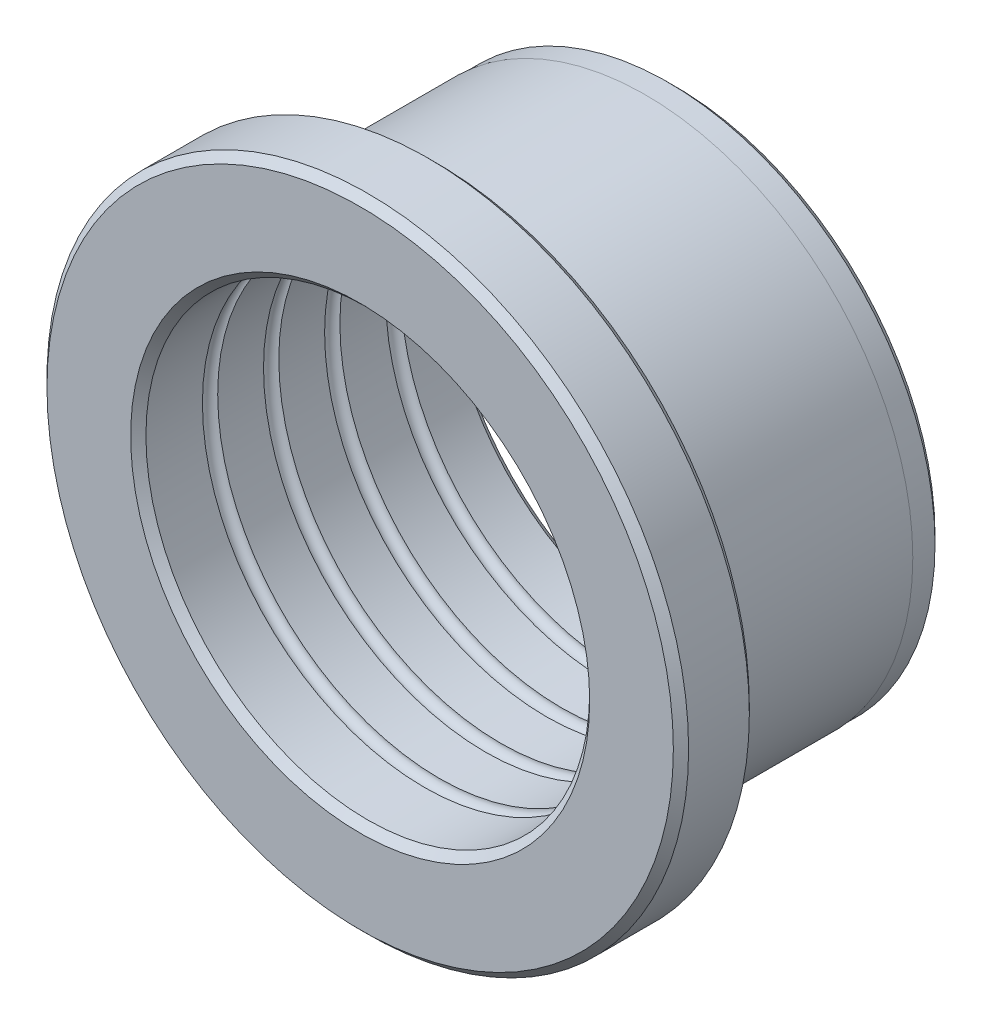
from build123d import *


with BuildPart() as part:
    # Sketch1 → Revolve1 (revolve)
    with BuildSketch(Plane(origin=(0, 0, 0), x_dir=(0, 0, -1), z_dir=(1, 0, 0))):
        with BuildLine():
            Line((0.5, 14.5275), (4.20000625, 14.5275))
            ThreePointArc((4.20000625, 14.5275), (4.7, 15.025), (5.19999375, 14.5275))
            Line((5.19999375, 14.5275), (8.20000625, 14.5275))
            ThreePointArc((8.20000625, 14.5275), (8.7, 15.025), (9.19999375, 14.5275))
            Line((9.19999375, 14.5275), (12.20000625, 14.5275))
            ThreePointArc((12.20000625, 14.5275), (12.7, 15.025), (13.19999375, 14.5275))
            Line((13.19999375, 14.5275), (16.20000625, 14.5275))
            ThreePointArc((16.20000625, 14.5275), (16.7, 15.025), (17.19999375, 14.5275))
            Line((17.19999375, 14.5275), (20.175, 14.5275))
            Line((20.175, 14.5275), (20.675, 15.0275))
            Line((20.675, 15.0275), (20.675, 16.9625))
            Line((20.675, 16.9625), (20.175, 17.4625))
            Line((20.175, 17.4625), (18.675, 17.4625))
            Line((18.675, 17.4625), (18.675, 17.5075))
            Line((18.675, 17.5075), (5.375, 17.5075))
            ThreePointArc((5.375, 17.5075), (5.092157288, 17.624657288), (4.975, 17.9075))
            Line((4.975, 17.9075), (4.975, 20.505))
            Line((4.975, 20.505), (4.475, 21.005))
            Line((4.475, 21.005), (0.5, 21.005))
            Line((0.5, 21.005), (0, 20.505))
            Line((0, 20.505), (0, 15.0275))
            Line((0, 15.0275), (0.5, 14.5275))
        make_face()
    revolve(axis=Axis((0, 0, 0), (0, 0, -1)))


solid = part.part
